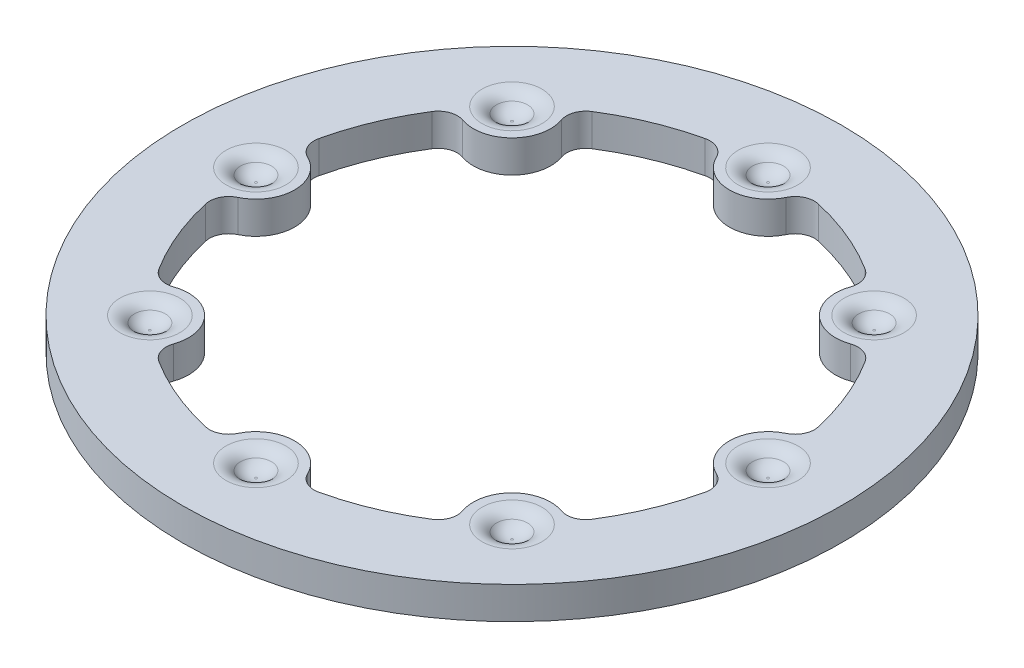
from build123d import *

# Parameters (mm, degrees)
SKETCH1_R                = 5.11
SKETCH1_R_2              = 3.97
BOSS_EXTRUDE1_DEPTH      = 0.5
SKETCH2_R                = 0.6
BOSS_EXTRUDE2_DEPTH      = 0.5
FILLET1_R                = 0.3
SKETCH5_R                = 0.3
CUT_EXTRUDE1_DEPTH       = 0.2
CIRPATTERN4_COUNT        = 8
FILLET1_OF_CIRPATTERN4_R = 0.3
FILLET2_R                = 0.3
FILLET3_R                = 0.3


with BuildPart() as part:
    # Sketch1 → Boss-Extrude1 (new body)
    with BuildSketch(Plane(origin=(0, 0, 0), x_dir=(1, 0, 0), z_dir=(0, 1, 0))):
        with Locations(Location((0, 0, 0), (0, 0, 270))):
            Circle(SKETCH1_R)
        with Locations(Location((0, 0, 0), (0, 0, 270))):
            Circle(SKETCH1_R_2, mode=Mode.SUBTRACT)
    extrude(amount=BOSS_EXTRUDE1_DEPTH)

    # Sketch2 → Boss-Extrude2 (add)
    with BuildSketch(Plane(origin=(0, 0.5, 0), x_dir=(1, 0, 0), z_dir=(0, 1, 0))):
        with Locations((0, 3.97)):
            Circle(SKETCH2_R)
    boss_extrude2 = extrude(amount=-BOSS_EXTRUDE2_DEPTH)

    # Fillet1
    fillet1_edges = [part.edges().sort_by_distance(p)[0] for p in [
        (-0.598284447, 0.25, -3.92465995),
        (0.598284447, 0.25, -3.92465995),
    ]]
    fillet(fillet1_edges, radius=FILLET1_R)

    # Sketch5 → Cut-Extrude1 (cut)
    with BuildSketch(Plane(origin=(0, 0.5, 0), x_dir=(1, 0, 0), z_dir=(0, 1, 0))):
        with Locations(Location((0, 3.97, 0), (0, 0, 270))):
            Circle(SKETCH5_R)
    cut_extrude1 = extrude(amount=-CUT_EXTRUDE1_DEPTH, mode=Mode.SUBTRACT)

    # CirPattern4: Boss-Extrude2, Cut-Extrude1 ×8 about axis
    cirpattern4_axis = Axis((0, 0, 0), (0, 1, 0))
    add([boss_extrude2.rotate(cirpattern4_axis, i * 360 / CIRPATTERN4_COUNT) for i in range(1, CIRPATTERN4_COUNT)])
    add([cut_extrude1.rotate(cirpattern4_axis, i * 360 / CIRPATTERN4_COUNT) for i in range(1, CIRPATTERN4_COUNT)], mode=Mode.SUBTRACT)

    # Fillet1 of CirPattern4
    fillet1_of_cirpattern4_edges = [part.edges().sort_by_distance(p)[0] for p in [
        (-3.198204654, 0.25, -2.352102674),
        (-2.352102674, 0.25, -3.198204654),
        (-3.92465995, 0.25, 0.598284447),
        (-3.92465995, 0.25, -0.598284447),
        (-2.352102674, 0.25, 3.198204654),
        (-3.198204654, 0.25, 2.352102674),
        (0.598284447, 0.25, 3.92465995),
        (-0.598284447, 0.25, 3.92465995),
        (3.198204654, 0.25, 2.352102674),
        (2.352102674, 0.25, 3.198204654),
        (3.92465995, 0.25, -0.598284447),
        (3.92465995, 0.25, 0.598284447),
        (2.352102674, 0.25, -3.198204654),
        (3.198204654, 0.25, -2.352102674),
    ]]
    fillet(fillet1_of_cirpattern4_edges, radius=FILLET1_OF_CIRPATTERN4_R)

    # Fillet2
    # the kernel refuses this fillet: 0.3 mm, written as the material it adds along each edge
    with BuildSketch(Plane(origin=(-2.807213921, 0.3, -2.807213921), x_dir=(0.7071067811865475, 0, 0.7071067811865475), z_dir=(-0.7071067811865475, 0, 0.7071067811865475))) as fillet2_piece_1:
        with BuildLine():
            CenterArc((0.017157288, 0.3), FILLET2_R, 270, 70.528779366)
            Line((0.017157288, 0), (0.017157288, -0.006))
            Line((0.017157288, -0.006), (0.3, -0.006))
            Line((0.3, -0.006), (0.306, 0))
            ThreePointArc((0.306, 0), (0.306, 0.1), (0.305656854, 0.198))
            Line((0.305656854, 0.198), (0.3, 0.2))
        make_face()
    revolve(axis=Axis((-2.807213921, 0.3, -2.807213921), (0, 1, 0)))
    with BuildSketch(Plane(origin=(-3.97, 0.3, 0), x_dir=(1, 0, 0), z_dir=(0, 0, 1))) as fillet2_piece_2:
        with BuildLine():
            CenterArc((0.017157288, 0.3), FILLET2_R, 270, 70.528779366)
            Line((0.017157288, 0), (0.017157288, -0.006))
            Line((0.017157288, -0.006), (0.3, -0.006))
            Line((0.3, -0.006), (0.306, 0))
            ThreePointArc((0.306, 0), (0.306, 0.1), (0.305656854, 0.198))
            Line((0.305656854, 0.198), (0.3, 0.2))
        make_face()
    revolve(axis=Axis((-3.97, 0.3, 0), (0, 1, 0)))
    with BuildSketch(Plane(origin=(-2.807213921, 0.3, 2.807213921), x_dir=(0.7071067811865475, 0, -0.7071067811865475), z_dir=(0.7071067811865475, 0, 0.7071067811865475))) as fillet2_piece_3:
        with BuildLine():
            CenterArc((0.017157288, 0.3), FILLET2_R, 270, 70.528779366)
            Line((0.017157288, 0), (0.017157288, -0.006))
            Line((0.017157288, -0.006), (0.3, -0.006))
            Line((0.3, -0.006), (0.306, 0))
            ThreePointArc((0.306, 0), (0.306, 0.1), (0.305656854, 0.198))
            Line((0.305656854, 0.198), (0.3, 0.2))
        make_face()
    revolve(axis=Axis((-2.807213921, 0.3, 2.807213921), (0, 1, 0)))
    with BuildSketch(Plane(origin=(0, 0.3, 3.97), x_dir=(0, 0, -1), z_dir=(1, 0, 0))) as fillet2_piece_4:
        with BuildLine():
            CenterArc((0.017157288, 0.3), FILLET2_R, 270, 70.528779366)
            Line((0.017157288, 0), (0.017157288, -0.006))
            Line((0.017157288, -0.006), (0.3, -0.006))
            Line((0.3, -0.006), (0.306, 0))
            ThreePointArc((0.306, 0), (0.306, 0.1), (0.305656854, 0.198))
            Line((0.305656854, 0.198), (0.3, 0.2))
        make_face()
    revolve(axis=Axis((0, 0.3, 3.97), (0, 1, 0)))
    with BuildSketch(Plane(origin=(2.807213921, 0.3, 2.807213921), x_dir=(-0.7071067811865475, 0, -0.7071067811865475), z_dir=(0.7071067811865475, 0, -0.7071067811865475))) as fillet2_piece_5:
        with BuildLine():
            CenterArc((0.017157288, 0.3), FILLET2_R, 270, 70.528779366)
            Line((0.017157288, 0), (0.017157288, -0.006))
            Line((0.017157288, -0.006), (0.3, -0.006))
            Line((0.3, -0.006), (0.306, 0))
            ThreePointArc((0.306, 0), (0.306, 0.1), (0.305656854, 0.198))
            Line((0.305656854, 0.198), (0.3, 0.2))
        make_face()
    revolve(axis=Axis((2.807213921, 0.3, 2.807213921), (0, 1, 0)))
    with BuildSketch(Plane(origin=(3.97, 0.3, 0), x_dir=(-1, 0, 0), z_dir=(0, 0, -1))) as fillet2_piece_6:
        with BuildLine():
            CenterArc((0.017157288, 0.3), FILLET2_R, 270, 70.528779366)
            Line((0.017157288, 0), (0.017157288, -0.006))
            Line((0.017157288, -0.006), (0.3, -0.006))
            Line((0.3, -0.006), (0.306, 0))
            ThreePointArc((0.306, 0), (0.306, 0.1), (0.305656854, 0.198))
            Line((0.305656854, 0.198), (0.3, 0.2))
        make_face()
    revolve(axis=Axis((3.97, 0.3, 0), (0, 1, 0)))
    with BuildSketch(Plane(origin=(2.807213921, 0.3, -2.807213921), x_dir=(-0.7071067811865475, 0, 0.7071067811865475), z_dir=(-0.7071067811865475, 0, -0.7071067811865475))) as fillet2_piece_7:
        with BuildLine():
            CenterArc((0.017157288, 0.3), FILLET2_R, 270, 70.528779366)
            Line((0.017157288, 0), (0.017157288, -0.006))
            Line((0.017157288, -0.006), (0.3, -0.006))
            Line((0.3, -0.006), (0.306, 0))
            ThreePointArc((0.306, 0), (0.306, 0.1), (0.305656854, 0.198))
            Line((0.305656854, 0.198), (0.3, 0.2))
        make_face()
    revolve(axis=Axis((2.807213921, 0.3, -2.807213921), (0, 1, 0)))
    with BuildSketch(Plane(origin=(0, 0.3, -3.97), x_dir=(0, 0, 1), z_dir=(-1, 0, 0))) as fillet2_piece_8:
        with BuildLine():
            CenterArc((0.017157288, 0.3), FILLET2_R, 270, 70.528779366)
            Line((0.017157288, 0), (0.017157288, -0.006))
            Line((0.017157288, -0.006), (0.3, -0.006))
            Line((0.3, -0.006), (0.306, 0))
            ThreePointArc((0.306, 0), (0.306, 0.1), (0.305656854, 0.198))
            Line((0.305656854, 0.198), (0.3, 0.2))
        make_face()
    revolve(axis=Axis((0, 0.3, -3.97), (0, 1, 0)))

    # Fillet3
    fillet3_edges = [part.edges().sort_by_distance(p)[0] for p in [
        (-3.019345956, 0.5, -3.019345956),
        (-4.27, 0.5, 0),
        (-3.019345956, 0.5, 3.019345956),
        (0, 0.5, 4.27),
        (3.019345956, 0.5, 3.019345956),
        (4.27, 0.5, 0),
        (3.019345956, 0.5, -3.019345956),
        (0, 0.5, -4.27),
    ]]
    fillet(fillet3_edges, radius=FILLET3_R)


solid = part.part
